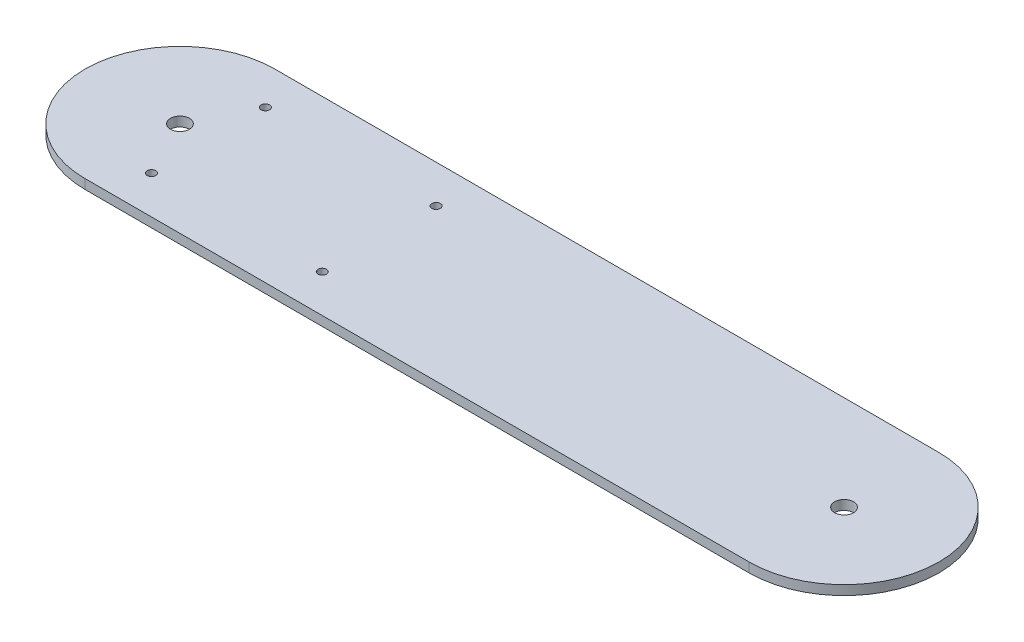
from build123d import *

# Parameters (mm, degrees)
SKETCH1_R           = 5
BOSS_EXTRUDE1_DEPTH = 5
SKETCH2_R           = 2.25
CUT_EXTRUDE1_DEPTH  = 5


with BuildPart() as part:
    # Sketch1 → Boss-Extrude1 (new body)
    with BuildSketch(Plane(origin=(0, 0, 0), x_dir=(1, 0, 0), z_dir=(0, 1, 0))):
        with BuildLine():
            Line((0, 50), (350, 50))
            ThreePointArc((350, 50), (400, 0), (350, -50))
            Line((350, -50), (0, -50))
            ThreePointArc((0, -50), (-50, 0), (0, 50))
        make_face()
        Circle(SKETCH1_R, mode=Mode.SUBTRACT)
        with Locations((350, 0)):
            Circle(SKETCH1_R, mode=Mode.SUBTRACT)
    extrude(amount=BOSS_EXTRUDE1_DEPTH)

    # Sketch2 → Cut-Extrude1 (cut)
    with BuildSketch(Plane(origin=(0, 5, 0), x_dir=(1, 0, 0), z_dir=(0, 1, 0))):
        with Locations((15, -30)):
            Circle(SKETCH2_R)
        with Locations((105, -30)):
            Circle(SKETCH2_R)
        with Locations((105, 30)):
            Circle(SKETCH2_R)
        with Locations((15, 30)):
            Circle(SKETCH2_R)
    extrude(amount=-CUT_EXTRUDE1_DEPTH, mode=Mode.SUBTRACT)


solid = part.part
